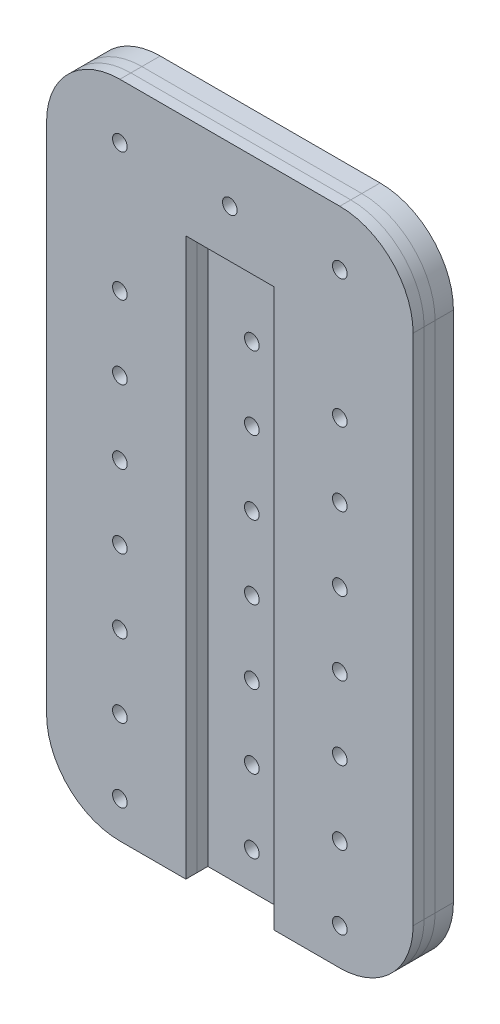
from build123d import *

# Parameters (mm, degrees)
SKETCH_1_R                 = 2
EXTRUDE_1_DEPTH            = 11
SPLIT_BODIES_1_OUTLINE_R   = 2
SPLIT_BODIES_1_DEPTH       = 5
SPLIT_BODIES_1_2_OUTLINE_R = 2
SPLIT_BODIES_1_2_DEPTH     = 5
SPLIT_START                = 8
SPLIT_BODIES_1_3_OUTLINE_R = 2
SPLIT_BODIES_1_3_DEPTH     = 3
SPLIT_BODIES_1_4_OUTLINE_R = 2
SPLIT_BODIES_1_4_DEPTH     = 3
SKETCH_2_W                 = 24
SKETCH_2_H                 = 152
CUT_EXTRUDE_1_DEPTH        = 6


# Read off the part's stored shape, not the designer's step: 分割1
with BuildPart() as part:
    # 草图1 → 凸台-拉伸1 (new body)
    with BuildSketch(Plane.XY):
        with BuildLine():
            Line((-30, 90), (30, 90))
            ThreePointArc((30, 90), (44.142135624, 84.142135624), (50, 70))
            Line((50, 70), (50, -70))
            ThreePointArc((50, -70), (44.142135624, -84.142135624), (30, -90))
            Line((30, -90), (-30, -90))
            ThreePointArc((-30, -90), (-44.142135624, -84.142135624), (-50, -70))
            Line((-50, -70), (-50, 70))
            ThreePointArc((-50, 70), (-44.142135624, 84.142135624), (-30, 90))
        make_face()
        with Locations((0, 40)):
            Circle(SKETCH_1_R, mode=Mode.SUBTRACT)
        with Locations((0, 75)):
            Circle(SKETCH_1_R, mode=Mode.SUBTRACT)
        with Locations((0, 20)):
            Circle(SKETCH_1_R, mode=Mode.SUBTRACT)
        Circle(SKETCH_1_R, mode=Mode.SUBTRACT)
        with Locations((0, -20)):
            Circle(SKETCH_1_R, mode=Mode.SUBTRACT)
        with Locations((0, -40)):
            Circle(SKETCH_1_R, mode=Mode.SUBTRACT)
        with Locations((0, -60)):
            Circle(SKETCH_1_R, mode=Mode.SUBTRACT)
        with Locations((0, -80)):
            Circle(SKETCH_1_R, mode=Mode.SUBTRACT)
        with Locations((30, 40)):
            Circle(SKETCH_1_R, mode=Mode.SUBTRACT)
        with Locations((30, 20)):
            Circle(SKETCH_1_R, mode=Mode.SUBTRACT)
        with Locations((30, 0)):
            Circle(SKETCH_1_R, mode=Mode.SUBTRACT)
        with Locations((30, -20)):
            Circle(SKETCH_1_R, mode=Mode.SUBTRACT)
        with Locations((30, -40)):
            Circle(SKETCH_1_R, mode=Mode.SUBTRACT)
        with Locations((30, -60)):
            Circle(SKETCH_1_R, mode=Mode.SUBTRACT)
        with Locations((30, -80)):
            Circle(SKETCH_1_R, mode=Mode.SUBTRACT)
        with Locations(Location((-30, 40, 0), (0, 0, 180))):
            Circle(SKETCH_1_R, mode=Mode.SUBTRACT)
        with Locations(Location((-30, 20, 0), (0, 0, 180))):
            Circle(SKETCH_1_R, mode=Mode.SUBTRACT)
        with Locations(Location((-30, 0, 0), (0, 0, 180))):
            Circle(SKETCH_1_R, mode=Mode.SUBTRACT)
        with Locations(Location((-30, -20, 0), (0, 0, 180))):
            Circle(SKETCH_1_R, mode=Mode.SUBTRACT)
        with Locations(Location((-30, -40, 0), (0, 0, 180))):
            Circle(SKETCH_1_R, mode=Mode.SUBTRACT)
        with Locations(Location((-30, -60, 0), (0, 0, 180))):
            Circle(SKETCH_1_R, mode=Mode.SUBTRACT)
        with Locations(Location((-30, -80, 0), (0, 0, 180))):
            Circle(SKETCH_1_R, mode=Mode.SUBTRACT)
        with Locations((30, 75)):
            Circle(SKETCH_1_R, mode=Mode.SUBTRACT)
        with Locations(Location((-30, 75, 0), (0, 0, 180))):
            Circle(SKETCH_1_R, mode=Mode.SUBTRACT)
    extrude(amount=EXTRUDE_1_DEPTH)

    # Split Bodies 1 2 outline → Split Bodies 1 2 (cut)
    with BuildSketch(Plane.XY):
        with BuildLine():
            ThreePointArc((-50, -70), (-44.142135624, -84.142135624), (-30, -90))
            Line((-30, -90), (30, -90))
            ThreePointArc((30, -90), (44.142135624, -84.142135624), (50, -70))
            Line((50, -70), (50, 70))
            ThreePointArc((50, 70), (44.142135624, 84.142135624), (30, 90))
            Line((30, 90), (-30, 90))
            ThreePointArc((-30, 90), (-44.142135624, 84.142135624), (-50, 70))
            Line((-50, 70), (-50, -70))
        make_face()
        with Locations((-30, -80)):
            Circle(SPLIT_BODIES_1_2_OUTLINE_R, mode=Mode.SUBTRACT)
        with Locations((-30, -60)):
            Circle(SPLIT_BODIES_1_2_OUTLINE_R, mode=Mode.SUBTRACT)
        with Locations((-30, -40)):
            Circle(SPLIT_BODIES_1_2_OUTLINE_R, mode=Mode.SUBTRACT)
        with Locations((-30, -20)):
            Circle(SPLIT_BODIES_1_2_OUTLINE_R, mode=Mode.SUBTRACT)
        with Locations((0, -80)):
            Circle(SPLIT_BODIES_1_2_OUTLINE_R, mode=Mode.SUBTRACT)
        with Locations((0, -60)):
            Circle(SPLIT_BODIES_1_2_OUTLINE_R, mode=Mode.SUBTRACT)
        with Locations((30, -80)):
            Circle(SPLIT_BODIES_1_2_OUTLINE_R, mode=Mode.SUBTRACT)
        with Locations((30, -60)):
            Circle(SPLIT_BODIES_1_2_OUTLINE_R, mode=Mode.SUBTRACT)
        with Locations((0, -40)):
            Circle(SPLIT_BODIES_1_2_OUTLINE_R, mode=Mode.SUBTRACT)
        with Locations((0, -20)):
            Circle(SPLIT_BODIES_1_2_OUTLINE_R, mode=Mode.SUBTRACT)
        with Locations((30, -40)):
            Circle(SPLIT_BODIES_1_2_OUTLINE_R, mode=Mode.SUBTRACT)
        with Locations((30, -20)):
            Circle(SPLIT_BODIES_1_2_OUTLINE_R, mode=Mode.SUBTRACT)
        with Locations((-30, 0)):
            Circle(SPLIT_BODIES_1_2_OUTLINE_R, mode=Mode.SUBTRACT)
        with Locations((-30, 20)):
            Circle(SPLIT_BODIES_1_2_OUTLINE_R, mode=Mode.SUBTRACT)
        with Locations((-30, 40)):
            Circle(SPLIT_BODIES_1_2_OUTLINE_R, mode=Mode.SUBTRACT)
        with Locations((-30, 75)):
            Circle(SPLIT_BODIES_1_2_OUTLINE_R, mode=Mode.SUBTRACT)
        Circle(SPLIT_BODIES_1_2_OUTLINE_R, mode=Mode.SUBTRACT)
        with Locations((0, 20)):
            Circle(SPLIT_BODIES_1_2_OUTLINE_R, mode=Mode.SUBTRACT)
        with Locations((0, 40)):
            Circle(SPLIT_BODIES_1_2_OUTLINE_R, mode=Mode.SUBTRACT)
        with Locations((30, 0)):
            Circle(SPLIT_BODIES_1_2_OUTLINE_R, mode=Mode.SUBTRACT)
        with Locations((30, 20)):
            Circle(SPLIT_BODIES_1_2_OUTLINE_R, mode=Mode.SUBTRACT)
        with Locations((30, 40)):
            Circle(SPLIT_BODIES_1_2_OUTLINE_R, mode=Mode.SUBTRACT)
        with Locations((0, 75)):
            Circle(SPLIT_BODIES_1_2_OUTLINE_R, mode=Mode.SUBTRACT)
        with Locations((30, 75)):
            Circle(SPLIT_BODIES_1_2_OUTLINE_R, mode=Mode.SUBTRACT)
    extrude(amount=SPLIT_BODIES_1_2_DEPTH, mode=Mode.SUBTRACT)

    # Split Bodies 1 3 outline → Split Bodies 1 3 (cut)
    with BuildSketch(Plane.XY.offset(SPLIT_START)):
        with BuildLine():
            ThreePointArc((-50, -70), (-44.142135624, -84.142135624), (-30, -90))
            Line((-30, -90), (30, -90))
            ThreePointArc((30, -90), (44.142135624, -84.142135624), (50, -70))
            Line((50, -70), (50, 70))
            ThreePointArc((50, 70), (44.142135624, 84.142135624), (30, 90))
            Line((30, 90), (-30, 90))
            ThreePointArc((-30, 90), (-44.142135624, 84.142135624), (-50, 70))
            Line((-50, 70), (-50, -70))
        make_face()
        with Locations((-30, -80)):
            Circle(SPLIT_BODIES_1_3_OUTLINE_R, mode=Mode.SUBTRACT)
        with Locations((-30, -60)):
            Circle(SPLIT_BODIES_1_3_OUTLINE_R, mode=Mode.SUBTRACT)
        with Locations((-30, -40)):
            Circle(SPLIT_BODIES_1_3_OUTLINE_R, mode=Mode.SUBTRACT)
        with Locations((-30, -20)):
            Circle(SPLIT_BODIES_1_3_OUTLINE_R, mode=Mode.SUBTRACT)
        with Locations((0, -80)):
            Circle(SPLIT_BODIES_1_3_OUTLINE_R, mode=Mode.SUBTRACT)
        with Locations((0, -60)):
            Circle(SPLIT_BODIES_1_3_OUTLINE_R, mode=Mode.SUBTRACT)
        with Locations((30, -80)):
            Circle(SPLIT_BODIES_1_3_OUTLINE_R, mode=Mode.SUBTRACT)
        with Locations((30, -60)):
            Circle(SPLIT_BODIES_1_3_OUTLINE_R, mode=Mode.SUBTRACT)
        with Locations((0, -40)):
            Circle(SPLIT_BODIES_1_3_OUTLINE_R, mode=Mode.SUBTRACT)
        with Locations((0, -20)):
            Circle(SPLIT_BODIES_1_3_OUTLINE_R, mode=Mode.SUBTRACT)
        with Locations((30, -40)):
            Circle(SPLIT_BODIES_1_3_OUTLINE_R, mode=Mode.SUBTRACT)
        with Locations((30, -20)):
            Circle(SPLIT_BODIES_1_3_OUTLINE_R, mode=Mode.SUBTRACT)
        with Locations((-30, 0)):
            Circle(SPLIT_BODIES_1_3_OUTLINE_R, mode=Mode.SUBTRACT)
        with Locations((-30, 20)):
            Circle(SPLIT_BODIES_1_3_OUTLINE_R, mode=Mode.SUBTRACT)
        with Locations((-30, 40)):
            Circle(SPLIT_BODIES_1_3_OUTLINE_R, mode=Mode.SUBTRACT)
        with Locations((-30, 75)):
            Circle(SPLIT_BODIES_1_3_OUTLINE_R, mode=Mode.SUBTRACT)
        Circle(SPLIT_BODIES_1_3_OUTLINE_R, mode=Mode.SUBTRACT)
        with Locations((0, 20)):
            Circle(SPLIT_BODIES_1_3_OUTLINE_R, mode=Mode.SUBTRACT)
        with Locations((0, 40)):
            Circle(SPLIT_BODIES_1_3_OUTLINE_R, mode=Mode.SUBTRACT)
        with Locations((30, 0)):
            Circle(SPLIT_BODIES_1_3_OUTLINE_R, mode=Mode.SUBTRACT)
        with Locations((30, 20)):
            Circle(SPLIT_BODIES_1_3_OUTLINE_R, mode=Mode.SUBTRACT)
        with Locations((30, 40)):
            Circle(SPLIT_BODIES_1_3_OUTLINE_R, mode=Mode.SUBTRACT)
        with Locations((0, 75)):
            Circle(SPLIT_BODIES_1_3_OUTLINE_R, mode=Mode.SUBTRACT)
        with Locations((30, 75)):
            Circle(SPLIT_BODIES_1_3_OUTLINE_R, mode=Mode.SUBTRACT)
    extrude(amount=SPLIT_BODIES_1_3_DEPTH, mode=Mode.SUBTRACT)


with BuildPart() as body_2:
    # Split Bodies 1 outline → Split Bodies 1 (new body)
    with BuildSketch(Plane.XY):
        with BuildLine():
            Line((-30, -90), (30, -90))
            ThreePointArc((30, -90), (44.142135624, -84.142135624), (50, -70))
            Line((50, -70), (50, 70))
            ThreePointArc((50, 70), (44.142135624, 84.142135624), (30, 90))
            Line((30, 90), (-30, 90))
            ThreePointArc((-30, 90), (-44.142135624, 84.142135624), (-50, 70))
            Line((-50, 70), (-50, -70))
            ThreePointArc((-50, -70), (-44.142135624, -84.142135624), (-30, -90))
        make_face()
        with Locations((-30, -80)):
            Circle(SPLIT_BODIES_1_OUTLINE_R, mode=Mode.SUBTRACT)
        with Locations((-30, -60)):
            Circle(SPLIT_BODIES_1_OUTLINE_R, mode=Mode.SUBTRACT)
        with Locations((-30, -40)):
            Circle(SPLIT_BODIES_1_OUTLINE_R, mode=Mode.SUBTRACT)
        with Locations((-30, -20)):
            Circle(SPLIT_BODIES_1_OUTLINE_R, mode=Mode.SUBTRACT)
        with Locations((0, -80)):
            Circle(SPLIT_BODIES_1_OUTLINE_R, mode=Mode.SUBTRACT)
        with Locations((0, -60)):
            Circle(SPLIT_BODIES_1_OUTLINE_R, mode=Mode.SUBTRACT)
        with Locations((30, -80)):
            Circle(SPLIT_BODIES_1_OUTLINE_R, mode=Mode.SUBTRACT)
        with Locations((30, -60)):
            Circle(SPLIT_BODIES_1_OUTLINE_R, mode=Mode.SUBTRACT)
        with Locations((0, -40)):
            Circle(SPLIT_BODIES_1_OUTLINE_R, mode=Mode.SUBTRACT)
        with Locations((0, -20)):
            Circle(SPLIT_BODIES_1_OUTLINE_R, mode=Mode.SUBTRACT)
        with Locations((30, -40)):
            Circle(SPLIT_BODIES_1_OUTLINE_R, mode=Mode.SUBTRACT)
        with Locations((30, -20)):
            Circle(SPLIT_BODIES_1_OUTLINE_R, mode=Mode.SUBTRACT)
        with Locations((-30, 0)):
            Circle(SPLIT_BODIES_1_OUTLINE_R, mode=Mode.SUBTRACT)
        with Locations((-30, 20)):
            Circle(SPLIT_BODIES_1_OUTLINE_R, mode=Mode.SUBTRACT)
        with Locations((-30, 40)):
            Circle(SPLIT_BODIES_1_OUTLINE_R, mode=Mode.SUBTRACT)
        with Locations((-30, 75)):
            Circle(SPLIT_BODIES_1_OUTLINE_R, mode=Mode.SUBTRACT)
        Circle(SPLIT_BODIES_1_OUTLINE_R, mode=Mode.SUBTRACT)
        with Locations((0, 20)):
            Circle(SPLIT_BODIES_1_OUTLINE_R, mode=Mode.SUBTRACT)
        with Locations((0, 40)):
            Circle(SPLIT_BODIES_1_OUTLINE_R, mode=Mode.SUBTRACT)
        with Locations((30, 0)):
            Circle(SPLIT_BODIES_1_OUTLINE_R, mode=Mode.SUBTRACT)
        with Locations((30, 20)):
            Circle(SPLIT_BODIES_1_OUTLINE_R, mode=Mode.SUBTRACT)
        with Locations((30, 40)):
            Circle(SPLIT_BODIES_1_OUTLINE_R, mode=Mode.SUBTRACT)
        with Locations((0, 75)):
            Circle(SPLIT_BODIES_1_OUTLINE_R, mode=Mode.SUBTRACT)
        with Locations((30, 75)):
            Circle(SPLIT_BODIES_1_OUTLINE_R, mode=Mode.SUBTRACT)
    extrude(amount=SPLIT_BODIES_1_DEPTH)


with BuildPart() as body_3:
    # Split Bodies 1 4 outline → Split Bodies 1 4 (new body)
    with BuildSketch(Plane.XY.offset(SPLIT_START)):
        with BuildLine():
            Line((-30, -90), (30, -90))
            ThreePointArc((30, -90), (44.142135624, -84.142135624), (50, -70))
            Line((50, -70), (50, 70))
            ThreePointArc((50, 70), (44.142135624, 84.142135624), (30, 90))
            Line((30, 90), (-30, 90))
            ThreePointArc((-30, 90), (-44.142135624, 84.142135624), (-50, 70))
            Line((-50, 70), (-50, -70))
            ThreePointArc((-50, -70), (-44.142135624, -84.142135624), (-30, -90))
        make_face()
        with Locations((-30, -80)):
            Circle(SPLIT_BODIES_1_4_OUTLINE_R, mode=Mode.SUBTRACT)
        with Locations((-30, -60)):
            Circle(SPLIT_BODIES_1_4_OUTLINE_R, mode=Mode.SUBTRACT)
        with Locations((-30, -40)):
            Circle(SPLIT_BODIES_1_4_OUTLINE_R, mode=Mode.SUBTRACT)
        with Locations((-30, -20)):
            Circle(SPLIT_BODIES_1_4_OUTLINE_R, mode=Mode.SUBTRACT)
        with Locations((0, -80)):
            Circle(SPLIT_BODIES_1_4_OUTLINE_R, mode=Mode.SUBTRACT)
        with Locations((0, -60)):
            Circle(SPLIT_BODIES_1_4_OUTLINE_R, mode=Mode.SUBTRACT)
        with Locations((30, -80)):
            Circle(SPLIT_BODIES_1_4_OUTLINE_R, mode=Mode.SUBTRACT)
        with Locations((30, -60)):
            Circle(SPLIT_BODIES_1_4_OUTLINE_R, mode=Mode.SUBTRACT)
        with Locations((0, -40)):
            Circle(SPLIT_BODIES_1_4_OUTLINE_R, mode=Mode.SUBTRACT)
        with Locations((0, -20)):
            Circle(SPLIT_BODIES_1_4_OUTLINE_R, mode=Mode.SUBTRACT)
        with Locations((30, -40)):
            Circle(SPLIT_BODIES_1_4_OUTLINE_R, mode=Mode.SUBTRACT)
        with Locations((30, -20)):
            Circle(SPLIT_BODIES_1_4_OUTLINE_R, mode=Mode.SUBTRACT)
        with Locations((-30, 0)):
            Circle(SPLIT_BODIES_1_4_OUTLINE_R, mode=Mode.SUBTRACT)
        with Locations((-30, 20)):
            Circle(SPLIT_BODIES_1_4_OUTLINE_R, mode=Mode.SUBTRACT)
        with Locations((-30, 40)):
            Circle(SPLIT_BODIES_1_4_OUTLINE_R, mode=Mode.SUBTRACT)
        with Locations((-30, 75)):
            Circle(SPLIT_BODIES_1_4_OUTLINE_R, mode=Mode.SUBTRACT)
        Circle(SPLIT_BODIES_1_4_OUTLINE_R, mode=Mode.SUBTRACT)
        with Locations((0, 20)):
            Circle(SPLIT_BODIES_1_4_OUTLINE_R, mode=Mode.SUBTRACT)
        with Locations((0, 40)):
            Circle(SPLIT_BODIES_1_4_OUTLINE_R, mode=Mode.SUBTRACT)
        with Locations((30, 0)):
            Circle(SPLIT_BODIES_1_4_OUTLINE_R, mode=Mode.SUBTRACT)
        with Locations((30, 20)):
            Circle(SPLIT_BODIES_1_4_OUTLINE_R, mode=Mode.SUBTRACT)
        with Locations((30, 40)):
            Circle(SPLIT_BODIES_1_4_OUTLINE_R, mode=Mode.SUBTRACT)
        with Locations((0, 75)):
            Circle(SPLIT_BODIES_1_4_OUTLINE_R, mode=Mode.SUBTRACT)
        with Locations((30, 75)):
            Circle(SPLIT_BODIES_1_4_OUTLINE_R, mode=Mode.SUBTRACT)
    extrude(amount=SPLIT_BODIES_1_4_DEPTH)


with BuildPart() as cut_extrude_1_tool:
    # 草图2 → 切除-拉伸1 (new body)
    with BuildSketch(Plane.XY.offset(11)):
        with Locations((0, -14)):
            Rectangle(SKETCH_2_W, SKETCH_2_H)
    extrude(amount=-CUT_EXTRUDE_1_DEPTH)


with BuildPart() as part_1:
    add(part.part)

    # 切除-拉伸1: cut by cut_extrude_1_tool
    add(cut_extrude_1_tool.part, mode=Mode.SUBTRACT)


with BuildPart() as body_3_1:
    add(body_3.part)

    # 切除-拉伸1: cut by cut_extrude_1_tool
    add(cut_extrude_1_tool.part, mode=Mode.SUBTRACT)


solid = Compound([body_2.part, part_1.part, body_3_1.part])
